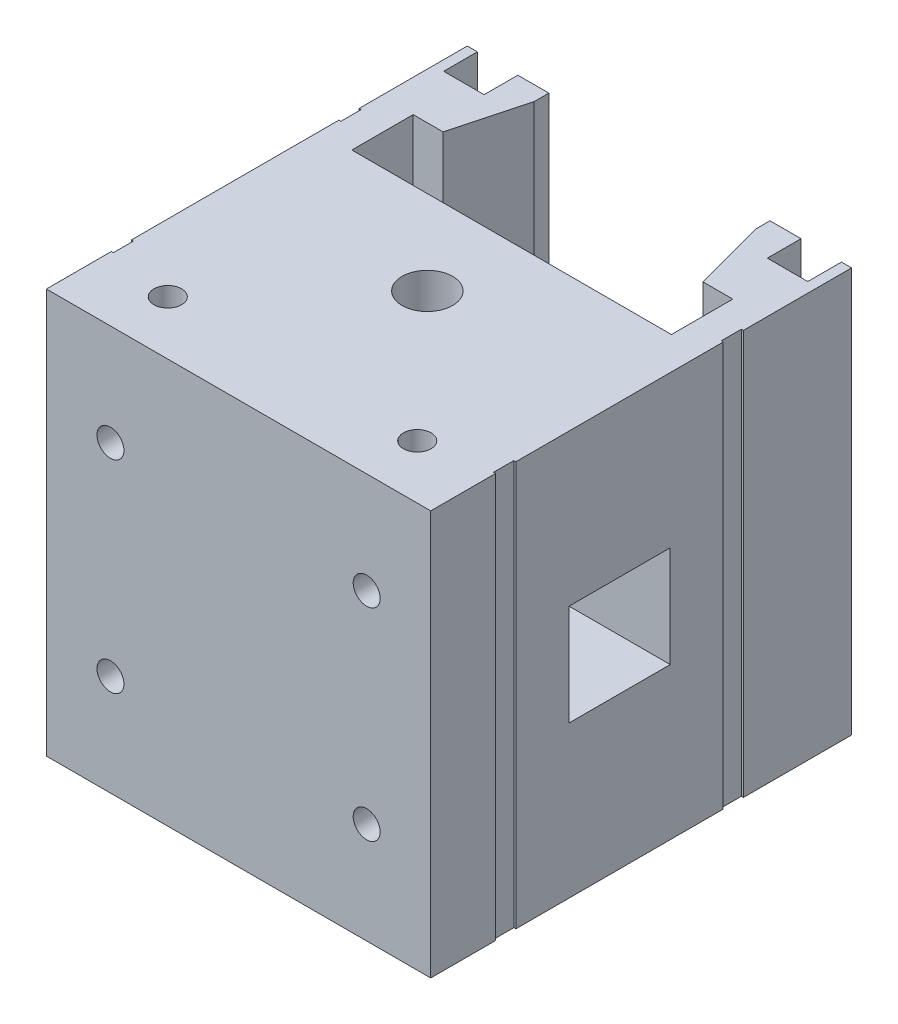
from build123d import *

# Parameters (mm, degrees)
SKETCH1_W            = 57
SKETCH1_H            = 28.7
BOSS_EXTRUDE1_DEPTH  = 60
SKETCH2_W            = 9
SKETCH2_H            = 4
CUT_EXTRUDE1_DEPTH   = 69.064473112
BOSS_EXTRUDE2_DEPTH  = 28.5
SKETCH6_W            = 15.5
SKETCH6_H            = 15.390476131
CUT_EXTRUDE2_DEPTH   = 80
BOSS_EXTRUDE5_DEPTH  = 60
SKETCH10_R           = 2
CUT_EXTRUDE3_DEPTH   = 24.530533394
SKETCH11_W           = 61.984050455
SKETCH11_H           = 43.227353824
SKETCH11_W_2         = 6
SKETCH11_H_2         = 2.542732203
CUT_EXTRUDE4_DEPTH   = 77.839254789
SKETCH13_W           = 6.011053281
SKETCH13_H           = 2.620549071
CUT_EXTRUDE5_DEPTH   = 77.839254789
SKETCH14_W           = 9
SKETCH14_H           = 4
BOSS_EXTRUDE7_DEPTH  = 60
SKETCH12_W           = 10.230058637
SKETCH12_H           = 6.686923691
BOSS_EXTRUDE6_DEPTH  = 60
SKETCH15_W           = 9
SKETCH15_H           = 4
BOSS_EXTRUDE8_DEPTH  = 60
SKETCH16_W           = 9
SKETCH16_H           = 1.78
CUT_EXTRUDE6_DEPTH   = 77.839254789
SKETCH17_W           = 25.75
SKETCH17_H           = 20.1006285
CUT_EXTRUDE7_DEPTH   = 77.839254789
SKETCH18_W           = 32.4
SKETCH18_H           = 12.613288226
CUT_EXTRUDE8_DEPTH   = 75.79485996
SKETCH19_W           = 57
SKETCH19_H           = 3.949842852
CUT_EXTRUDE9_DEPTH   = 75.79485996
SKETCH20_W           = 6
SKETCH20_H           = 3.5
CUT_EXTRUDE10_DEPTH  = 75.79485996
SKETCH21_W           = 6
SKETCH21_H           = 3.5
CUT_EXTRUDE11_DEPTH  = 1.5
SKETCH23_R           = 3.75
CUT_EXTRUDE12_DEPTH  = 59.313986952
SKETCH24_R           = 2
CUT_EXTRUDE13_DEPTH  = 59.313986952
SKETCH25_R           = 3.960956754
CUT_EXTRUDE14_DEPTH  = 10
SKETCH26_W           = 6
SKETCH26_H           = 10
SKETCH26_H_2         = 15
CUT_EXTRUDE15_DEPTH  = 5
SKETCH28_W           = 15.020317418
SKETCH28_H           = 14.99999997
CUT_EXTRUDE18_DEPTH  = 90.615964406
SKETCH32_W           = 57
SKETCH32_H           = 8
BOSS_EXTRUDE10_DEPTH = 15.97
SKETCH33_R           = 2.05
CUT_EXTRUDE20_DEPTH  = 84.351222025
FILLET2_R            = 2
CHAMFER1_SIZE        = 5
CUT_EXTRUDE21_DEPTH  = 84.351222025
SKETCH36_W           = 0.6
SKETCH36_H           = 3
CUT_EXTRUDE22_DEPTH  = 84.351222025
SKETCH37_W           = 6
SKETCH37_H           = 60
CUT_EXTRUDE23_DEPTH  = 5
BOSS_EXTRUDE11_DEPTH = 57
SKETCH39_R           = 2.05
SKETCH39_W           = 0.3
SKETCH39_H           = 3
CUT_EXTRUDE24_DEPTH  = 84.351222025
SKETCH40_R           = 2
CUT_EXTRUDE25_DEPTH  = 45


with BuildPart() as part:
    # Sketch1 → Boss-Extrude1 (new body)
    with BuildSketch(Plane(origin=(0, 0, 0), x_dir=(1, 0, 0), z_dir=(0, 1, 0))):
        with Locations((0, -0.5)):
            Rectangle(SKETCH1_W, SKETCH1_H)
        Polygon((23.07, -9.85), (-23.07, -9.85), (-23.5, -9.42), (-23.5, -0.95), (-19.09385128, -0.95), (-19, -0.599742255), (-16.2, 9.85), (16.2, 9.85), (19, -0.599742255), (19.09385128, -0.95), (23.5, -0.95), (23.5, -2.9), (23.5, -9.42), align=None, mode=Mode.SUBTRACT)
    extrude(amount=BOSS_EXTRUDE1_DEPTH)

    # Sketch2 → Cut-Extrude1 (cut, through all)
    with BuildSketch(Plane.XZ):
        with Locations((24, -10.0706285)):
            Rectangle(SKETCH2_W, SKETCH2_H)
        with Locations((-24, -10.0706285)):
            Rectangle(SKETCH2_W, SKETCH2_H)
    extrude(amount=-CUT_EXTRUDE1_DEPTH, mode=Mode.SUBTRACT)

    # Sketch5 → Boss-Extrude2 (add, symmetric)
    with BuildSketch(Plane(origin=(0, 0, 0), x_dir=(0, 0, -1), z_dir=(1, 0, 0))):
        with BuildLine():
            Line((-14.85, 0), (-14.85, 23.200000017))
            Line((-14.85, 23.200000017), (-15.549999973, 22.50000003))
            Line((-15.549999973, 22.50000003), (-29.149999973, 22.50000003))
            Line((-29.149999973, 22.50000003), (-29.849999973, 23.20000003))
            Line((-29.849999973, 23.20000003), (-29.849999973, 25.743360053))
            ThreePointArc((-29.849999973, 25.743360053), (-29.773879502, 26.126043492), (-29.557106746, 26.450466847))
            Line((-29.557106746, 26.450466847), (-27.237157266, 28.770416328))
            ThreePointArc((-27.237157266, 28.770416328), (-27.150448162, 28.900185674), (-27.119999973, 29.053259055))
            Line((-27.119999973, 29.053259055), (-27.119999973, 30.615319642))
            ThreePointArc((-27.119999973, 30.615319642), (-27.150448164, 30.768393021), (-27.237157268, 30.898162365))
            Line((-27.237157268, 30.898162365), (-27.431588163, 31.09259326))
            ThreePointArc((-27.431588163, 31.09259326), (-27.613507965, 31.297692563), (-27.620638933, 31.57175403))
            ThreePointArc((-27.620638933, 31.57175403), (-28.017573243, 32.42857618), (-28.828543655, 32.91234062))
            ThreePointArc((-28.828543655, 32.91234062), (-29.01918836, 33.020436377), (-29.124259054, 33.212764861))
            Line((-29.124259054, 33.212764861), (-29.156235284, 33.354092333))
            ThreePointArc((-29.156235284, 33.354092333), (-29.24659278, 33.53064407), (-29.410649592, 33.642090719))
            Line((-29.410649592, 33.642090719), (-29.585724304, 33.70524196))
            ThreePointArc((-29.585724304, 33.70524196), (-29.777329878, 33.851609246), (-29.849999973, 34.081511694))
            Line((-29.849999973, 34.081511694), (-29.849999973, 34.837490602))
            ThreePointArc((-29.849999973, 34.837490602), (-29.772088513, 35.074680338), (-29.568705112, 35.219471078))
            Line((-29.568705112, 35.219471078), (-29.427668799, 35.263299846))
            ThreePointArc((-29.427668799, 35.263299846), (-29.25116358, 35.375371369), (-29.155313737, 35.561185593))
            Line((-29.155313737, 35.561185593), (-29.125010632, 35.702102112))
            ThreePointArc((-29.125010632, 35.702102112), (-29.020526118, 35.897067182), (-28.828406063, 36.006695082))
            ThreePointArc((-28.828406063, 36.006695082), (-28.025619489, 36.481556021), (-27.62403672, 37.32339358))
            ThreePointArc((-27.62403672, 37.32339358), (-27.540484938, 37.407225271), (-27.43605838, 37.46293655))
            Line((-27.43605838, 37.46293655), (-27.39899493, 37.5))
            Line((-27.39899493, 37.5), (-17.30100503, 37.5))
            Line((-17.30100503, 37.5), (-17.26394158, 37.46293655))
            ThreePointArc((-17.26394158, 37.46293655), (-17.159515017, 37.407225278), (-17.07596324, 37.32339358))
            ThreePointArc((-17.07596324, 37.32339358), (-16.674380468, 36.481556018), (-15.871593887, 36.006695079))
            ThreePointArc((-15.871593887, 36.006695079), (-15.679473839, 35.897067189), (-15.574989331, 35.702102127))
            Line((-15.574989331, 35.702102127), (-15.544686222, 35.561185587))
            ThreePointArc((-15.544686222, 35.561185587), (-15.448836377, 35.375371364), (-15.272331158, 35.263299843))
            Line((-15.272331158, 35.263299843), (-15.131294869, 35.219471083))
            ThreePointArc((-15.131294869, 35.219471083), (-14.927911462, 35.074680333), (-14.85, 34.837490586))
            Line((-14.85, 34.837490586), (-14.85, 60))
            Line((-14.85, 60), (-34.380533394, 60))
            Line((-34.380533394, 60), (-34.380533394, 0))
            Line((-34.380533394, 0), (-14.85, 0))
        make_face()
        with BuildLine():
            ThreePointArc((-15.142893227, 26.450466847), (-14.926120471, 26.126043492), (-14.85, 25.743360053))
            Line((-14.85, 25.743360053), (-14.85, 34.081511674))
            ThreePointArc((-14.85, 34.081511674), (-14.922670087, 33.851609245), (-15.114275644, 33.70524197))
            Line((-15.114275644, 33.70524197), (-15.289350386, 33.642090718))
            ThreePointArc((-15.289350386, 33.642090718), (-15.453407192, 33.53064407), (-15.543764688, 33.354092339))
            Line((-15.543764688, 33.354092339), (-15.57574092, 33.21276486))
            ThreePointArc((-15.57574092, 33.21276486), (-15.680811613, 33.020436377), (-15.871456319, 32.91234062))
            ThreePointArc((-15.871456319, 32.91234062), (-16.68242673, 32.42857618), (-17.07936104, 31.57175403))
            ThreePointArc((-17.07936104, 31.57175403), (-17.086492012, 31.297692565), (-17.26841181, 31.09259326))
            Line((-17.26841181, 31.09259326), (-17.462842708, 30.898162362))
            ThreePointArc((-17.462842708, 30.898162362), (-17.549551812, 30.768393016), (-17.58, 30.615319635))
            Line((-17.58, 30.615319635), (-17.58, 29.053259048))
            ThreePointArc((-17.58, 29.053259048), (-17.54955181, 28.900185669), (-17.462842705, 28.770416325))
            Line((-17.462842705, 28.770416325), (-15.142893227, 26.450466847))
        make_face()
    extrude(amount=BOSS_EXTRUDE2_DEPTH, both=True)

    # Sketch6 → Cut-Extrude2 (cut)
    with BuildSketch(Plane(origin=(0, 60, 0), x_dir=(1, 0, 0), z_dir=(0, 1, 0))):
        with Locations((0, 12.050145064)):
            Rectangle(SKETCH6_W, SKETCH6_H)
    extrude(amount=-CUT_EXTRUDE2_DEPTH, mode=Mode.SUBTRACT)

    # Sketch9 → Boss-Extrude5 (add)
    with BuildSketch(Plane(origin=(0, 60, 0), x_dir=(1, 0, 0), z_dir=(0, 1, 0))):
        Polygon((-19.5, 13.85), (-19.5, 29.1706285), (-28.5, 29.1706285), (-28.5, 26.1706285), (-33.5, 26.1706285), (-33.5, 32.1706285), (-14.5, 32.1706285), (-14.5, 13.85), align=None)
        Polygon((30.2, 12.85), (30.2, 28.735786438), (19.5, 28.735786438), (19.5, 13.85), (14.5, 13.85), (14.5, 32.1706285), (33.5, 32.1706285), (33.5, 12.85), align=None)
    extrude(amount=-BOSS_EXTRUDE5_DEPTH)

    # Sketch10 → Cut-Extrude3 (cut)
    with BuildSketch(Plane.XY.offset(34.380533394)):
        with Locations((19, 45)):
            Circle(SKETCH10_R)
        with Locations((19, 15)):
            Circle(SKETCH10_R)
        with Locations((-19, 15)):
            Circle(SKETCH10_R)
        with Locations((-19, 45)):
            Circle(SKETCH10_R)
    extrude(amount=-CUT_EXTRUDE3_DEPTH, mode=Mode.SUBTRACT)

    # Sketch11 → Cut-Extrude4 (cut, through all)
    with BuildSketch(Plane.XZ):
        with Locations((44.734239641, -35.463676912)):
            Rectangle(SKETCH11_W, SKETCH11_H)
        with Locations((32.2, -12.566438328)):
            Rectangle(SKETCH11_W_2, SKETCH11_H_2)
    extrude(amount=-CUT_EXTRUDE4_DEPTH, mode=Mode.SUBTRACT)


with BuildPart() as cut_extrude4_piece_1:
    # of the separate pieces the step leaves, piece 1, a body of its own (cut_extrude4_pieces)
    add(part.part.solids().sort_by_distance((-28.5, 23.200000017, 14.85))[0])

    # Sketch14 → Boss-Extrude7 (add, through all)
    with BuildSketch(Plane(origin=(0, 0, 0), x_dir=(-1, 0, 0), z_dir=(0, -1, 0))):
        with Locations((-24, 10.0706285)):
            Rectangle(SKETCH14_W, SKETCH14_H)
    extrude(amount=-BOSS_EXTRUDE7_DEPTH)

    # Sketch12 → Boss-Extrude6 (add, through all)
    with BuildSketch(Plane.XZ):
        with Locations((23.384970682, -10.506538155)):
            Rectangle(SKETCH12_W, SKETCH12_H)
    extrude(amount=-BOSS_EXTRUDE6_DEPTH)

    # Sketch15 → Boss-Extrude8 (add, through all)
    with BuildSketch(Plane(origin=(0, 60, 0), x_dir=(1, 0, 0), z_dir=(0, 1, 0))):
        with Locations((-24, 10.0706285)):
            Rectangle(SKETCH15_W, SKETCH15_H)
    extrude(amount=-BOSS_EXTRUDE8_DEPTH)

    # Sketch16 → Cut-Extrude6 (cut, through all)
    with BuildSketch(Plane(origin=(0, 60, 0), x_dir=(1, 0, 0), z_dir=(0, 1, 0))):
        with Locations((-24, 12.96)):
            Rectangle(SKETCH16_W, SKETCH16_H)
    extrude(amount=-CUT_EXTRUDE6_DEPTH, mode=Mode.SUBTRACT)

    # Sketch17 → Cut-Extrude7 (cut, through all)
    with BuildSketch(Plane(origin=(0, 60, 0), x_dir=(1, 0, 0), z_dir=(0, 1, 0))):
        with Locations((-20.625, 22.12031425)):
            Rectangle(SKETCH17_W, SKETCH17_H)
    extrude(amount=-CUT_EXTRUDE7_DEPTH, mode=Mode.SUBTRACT)

    # Sketch18 → Cut-Extrude8 (cut, through all)
    with BuildSketch(Plane(origin=(0, 60, 0), x_dir=(1, 0, 0), z_dir=(0, 1, 0))):
        with Locations((0, 16.156644113)):
            Rectangle(SKETCH18_W, SKETCH18_H)
    extrude(amount=-CUT_EXTRUDE8_DEPTH, mode=Mode.SUBTRACT)

    # Sketch19 → Cut-Extrude9 (cut, through all)
    with BuildSketch(Plane(origin=(0, 60, 0), x_dir=(1, 0, 0), z_dir=(0, 1, 0))):
        with Locations((0, 14.044921426)):
            Rectangle(SKETCH19_W, SKETCH19_H)
    extrude(amount=-CUT_EXTRUDE9_DEPTH, mode=Mode.SUBTRACT)

    # Sketch20 → Cut-Extrude10 (cut, through all)
    with BuildSketch(Plane(origin=(0, 60, 0), x_dir=(1, 0, 0), z_dir=(0, 1, 0))):
        with Locations((-24, 8.82)):
            Rectangle(SKETCH20_W, SKETCH20_H)
        with Locations((24, 8.82)):
            Rectangle(SKETCH20_W, SKETCH20_H)
    extrude(amount=-CUT_EXTRUDE10_DEPTH, mode=Mode.SUBTRACT)

    # Sketch21 → Cut-Extrude11 (cut)
    with BuildSketch(Plane(origin=(0, 0, -12.07), x_dir=(-1, 0, 0), z_dir=(0, 0, -1))):
        with Locations((-24, 48.25)):
            Rectangle(SKETCH21_W, SKETCH21_H)
        with Locations((24, 48.25)):
            Rectangle(SKETCH21_W, SKETCH21_H)
        with Locations((24, 11.75)):
            Rectangle(SKETCH21_W, SKETCH21_H)
        with Locations((-24, 11.75)):
            Rectangle(SKETCH21_W, SKETCH21_H)
    extrude(amount=-CUT_EXTRUDE11_DEPTH, mode=Mode.SUBTRACT)

    # Sketch23 → Cut-Extrude12 (cut, through all)
    with BuildSketch(Plane(origin=(0, 22.50000003, 0), x_dir=(1, 0, 0), z_dir=(0, 1, 0))):
        with Locations(Location((0, -22.349999973, 0), (0, 0, 90))):
            Circle(SKETCH23_R)
    extrude(amount=CUT_EXTRUDE12_DEPTH, mode=Mode.SUBTRACT)

    # Sketch24 → Cut-Extrude13 (cut, through all)
    with BuildSketch(Plane(origin=(0, 22.50000003, 0), x_dir=(1, 0, 0), z_dir=(0, 1, 0))):
        with Locations(Location((0, -22.349999973, 0), (0, 0, 270))):
            Circle(SKETCH24_R)
    extrude(amount=-CUT_EXTRUDE13_DEPTH, mode=Mode.SUBTRACT)

    # Sketch25 → Cut-Extrude14 (cut)
    with BuildSketch(Plane.XY.offset(34.380533394)):
        with Locations((19, 15)):
            Circle(SKETCH25_R)
        with Locations((-19, 15)):
            Circle(SKETCH25_R)
        with Locations((19, 45)):
            Circle(SKETCH25_R)
        with Locations((-19, 45)):
            Circle(SKETCH25_R)
    extrude(amount=-CUT_EXTRUDE14_DEPTH, mode=Mode.SUBTRACT)

    # Sketch26 → Cut-Extrude15 (cut)
    with BuildSketch(Plane(origin=(0, 0, -12.07), x_dir=(-1, 0, 0), z_dir=(0, 0, -1))):
        with Locations((24, 30)):
            Rectangle(SKETCH26_W, SKETCH26_H)
        with Locations((24, 7.5)):
            Rectangle(SKETCH26_W, SKETCH26_H_2)
        with Locations((24, 52.5)):
            Rectangle(SKETCH26_W, SKETCH26_H_2)
        with Locations((-24, 30)):
            Rectangle(SKETCH26_W, SKETCH26_H)
        with Locations((-24, 52.5)):
            Rectangle(SKETCH26_W, SKETCH26_H_2)
        with Locations((-24, 7.5)):
            Rectangle(SKETCH26_W, SKETCH26_H_2)
    extrude(amount=-CUT_EXTRUDE15_DEPTH, mode=Mode.SUBTRACT)

    # Sketch28 → Cut-Extrude18 (cut, through all)
    with BuildSketch(Plane.ZY.offset(28.5)):
        with Locations((22.339841264, 30.000000015)):
            Rectangle(SKETCH28_W, SKETCH28_H)
    extrude(amount=-CUT_EXTRUDE18_DEPTH, mode=Mode.SUBTRACT)

    # Sketch32 → Boss-Extrude10 (add)
    with BuildSketch(Plane.XY.offset(34.380533394)):
        with Locations((0, 4)):
            Rectangle(SKETCH32_W, SKETCH32_H)
        with Locations((0, 56)):
            Rectangle(SKETCH32_W, SKETCH32_H)
    extrude(amount=BOSS_EXTRUDE10_DEPTH)

    # Sketch33 → Cut-Extrude20 (cut, through all)
    with BuildSketch(Plane(origin=(0, 60, 0), x_dir=(1, 0, 0), z_dir=(0, 1, 0))):
        with Locations(Location((18.5, -42.350533394, 0), (0, 0, 270))):
            Circle(SKETCH33_R)
        with Locations(Location((-18.5, -42.350533394, 0), (0, 0, 270))):
            Circle(SKETCH33_R)
    extrude(amount=-CUT_EXTRUDE20_DEPTH, mode=Mode.SUBTRACT)

    # Fillet2
    fillet2_edges = [cut_extrude4_piece_1.edges().sort_by_distance(p)[0] for p in [
        (-27, 30, -7.07),
        (-21, 30, -7.07),
        (27, 30, -7.07),
        (21, 30, -7.07),
        (-21, 15, -11.32),
        (-27, 15, -11.32),
        (-27, 45, -11.32),
        (-21, 45, -11.32),
        (21, 45, -11.32),
        (27, 45, -11.32),
        (27, 15, -11.32),
        (21, 15, -11.32),
    ]]
    fillet(fillet2_edges, radius=FILLET2_R)

    # Chamfer1
    # the kernel refuses this chamfer: 5 mm, written as the material it adds along each edge
    with BuildSketch(Plane(origin=(-28.5, 52, 34.380533394), x_dir=(0, 0.027495876610586317, 0.9996219169112968), z_dir=(1, 0, 0))) as chamfer1_piece_1_section:
        Polygon((CHAMFER1_SIZE * 0.999621916911, CHAMFER1_SIZE * 0.0274958766106), (-CHAMFER1_SIZE * 0.0274958766106, CHAMFER1_SIZE * 0.999621916911), (0, 0), align=None)
    chamfer1_piece_1 = extrude(amount=57, mode=Mode.PRIVATE)
    chamfer1_piece_1 = chamfer1_piece_1 - Plane(origin=(-19, 45, 36.059443485), x_dir=(1, 0, 0), z_dir=(0, 0, 1)) * Cylinder(3.960956754, 134, mode=Mode.PRIVATE)
    chamfer1_piece_1 = chamfer1_piece_1 - Plane(origin=(19, 45, 36.059443485), x_dir=(1, 0, 0), z_dir=(0, 0, 1)) * Cylinder(3.960956754, 134, mode=Mode.PRIVATE)
    add(chamfer1_piece_1)
    with BuildSketch(Plane(origin=(-28.5, 8, 34.380533394), x_dir=(0, 0.9996219169112968, -0.027495876610586317), z_dir=(1, 0, 0))) as chamfer1_piece_2_section:
        Polygon((CHAMFER1_SIZE * 0.999621916911, CHAMFER1_SIZE * 0.0274958766106), (-CHAMFER1_SIZE * 0.0274958766106, CHAMFER1_SIZE * 0.999621916911), (0, 0), align=None)
    chamfer1_piece_2 = extrude(amount=57, mode=Mode.PRIVATE)
    chamfer1_piece_2 = chamfer1_piece_2 - Plane(origin=(-19, 15, 36.059443438), x_dir=(1, 0, 0), z_dir=(0, 0, 1)) * Cylinder(3.960956754, 134, mode=Mode.PRIVATE)
    chamfer1_piece_2 = chamfer1_piece_2 - Plane(origin=(19, 15, 36.059443438), x_dir=(1, 0, 0), z_dir=(0, 0, 1)) * Cylinder(3.960956754, 134, mode=Mode.PRIVATE)
    add(chamfer1_piece_2)

    # Sketch35 → Cut-Extrude21 (cut, through all)
    with BuildSketch(Plane.XZ):
        Polygon((-16.2, -12.07), (-16.2, -9.85), (-19.09385128, 0.95), (-23.5, 0.95), (-23.5, 9.42), (-23.07, 9.85), (-23.7, 9.85), (-23.7, 0.75), (-19.247316678, 0.75), (-16.4, -9.8763305), (-16.4, -12.07), align=None)
        Polygon((16.4, -12.07), (16.2, -12.07), (16.2, -9.85), (19.09385128, 0.95), (23.5, 0.95), (23.5, 9.42), (23.07, 9.85), (23.7, 9.85), (23.7, 0.75), (19.247316678, 0.75), (16.4, -9.8763305), align=None)
    extrude(amount=-CUT_EXTRUDE21_DEPTH, mode=Mode.SUBTRACT)

    # Sketch36 → Cut-Extrude22 (cut, through all)
    with BuildSketch(Plane.XZ):
        with Locations((-28.5, 39.220890667)):
            Rectangle(SKETCH36_W, SKETCH36_H)
        with Locations((-28.5, 5.480176119)):
            Rectangle(SKETCH36_W, SKETCH36_H)
        with Locations((28.5, 5.480176119)):
            Rectangle(SKETCH36_W, SKETCH36_H)
        with Locations((28.5, 39.220890667)):
            Rectangle(SKETCH36_W, SKETCH36_H)
    extrude(amount=-CUT_EXTRUDE22_DEPTH, mode=Mode.SUBTRACT)

    # Sketch37 → Cut-Extrude23 (cut)
    with BuildSketch(Plane(origin=(0, 0, -12.07), x_dir=(-1, 0, 0), z_dir=(0, 0, -1))):
        with Locations((24, 30)):
            Rectangle(SKETCH37_W, SKETCH37_H)
        with Locations((-24, 30)):
            Rectangle(SKETCH37_W, SKETCH37_H)
    extrude(amount=-CUT_EXTRUDE23_DEPTH, mode=Mode.SUBTRACT)

    # Sketch38 → Boss-Extrude11 (add, through all)
    with BuildSketch(Plane.ZY.offset(28.5)):
        Polygon((50.350533394, 52), (40.720890667, 52), (39.380533394, 52), (34.380533394, 47), (34.380533394, 13), (39.380533394, 8), (50.350533394, 8), align=None)
    extrude(amount=-BOSS_EXTRUDE11_DEPTH)

    # Sketch39 → Cut-Extrude24 (cut, through all)
    with BuildSketch(Plane.XZ):
        with Locations(Location((-18.5, 42.350533394, 0), (0, 0, 90))):
            Circle(SKETCH39_R)
        with Locations(Location((18.5, 42.350533394, 0), (0, 0, 90))):
            Circle(SKETCH39_R)
        with Locations((-28.35, 39.220890667)):
            Rectangle(SKETCH39_W, SKETCH39_H)
        with Locations((28.35, 39.220890667)):
            Rectangle(SKETCH39_W, SKETCH39_H)
    extrude(amount=-CUT_EXTRUDE24_DEPTH, mode=Mode.SUBTRACT)

    # Sketch40 → Cut-Extrude25 (cut)
    with BuildSketch(Plane(origin=(0, 0, 9.85), x_dir=(-1, 0, 0), z_dir=(0, 0, -1))):
        with Locations(Location((19, 45, 0), (0, 0, 180))):
            Circle(SKETCH40_R)
        with Locations(Location((19, 15, 0), (0, 0, 180))):
            Circle(SKETCH40_R)
        with Locations(Location((-19, 45, 0), (0, 0, 180))):
            Circle(SKETCH40_R)
        with Locations(Location((-19, 15, 0), (0, 0, 180))):
            Circle(SKETCH40_R)
    extrude(amount=-CUT_EXTRUDE25_DEPTH, mode=Mode.SUBTRACT)


with BuildPart() as cut_extrude4_piece_2:
    # of the separate pieces the step leaves, piece 2, a body of its own (cut_extrude4_pieces)
    add(part.part.solids().sort_by_distance((33.5, 0, -13.85))[0])

    # Sketch13 → Cut-Extrude5 (cut, through all)
    with BuildSketch(Plane.XZ):
        with Locations((32.65361778, -14.054923964)):
            Rectangle(SKETCH13_W, SKETCH13_H)
    extrude(amount=-CUT_EXTRUDE5_DEPTH, mode=Mode.SUBTRACT)


solid = cut_extrude4_piece_1.part
